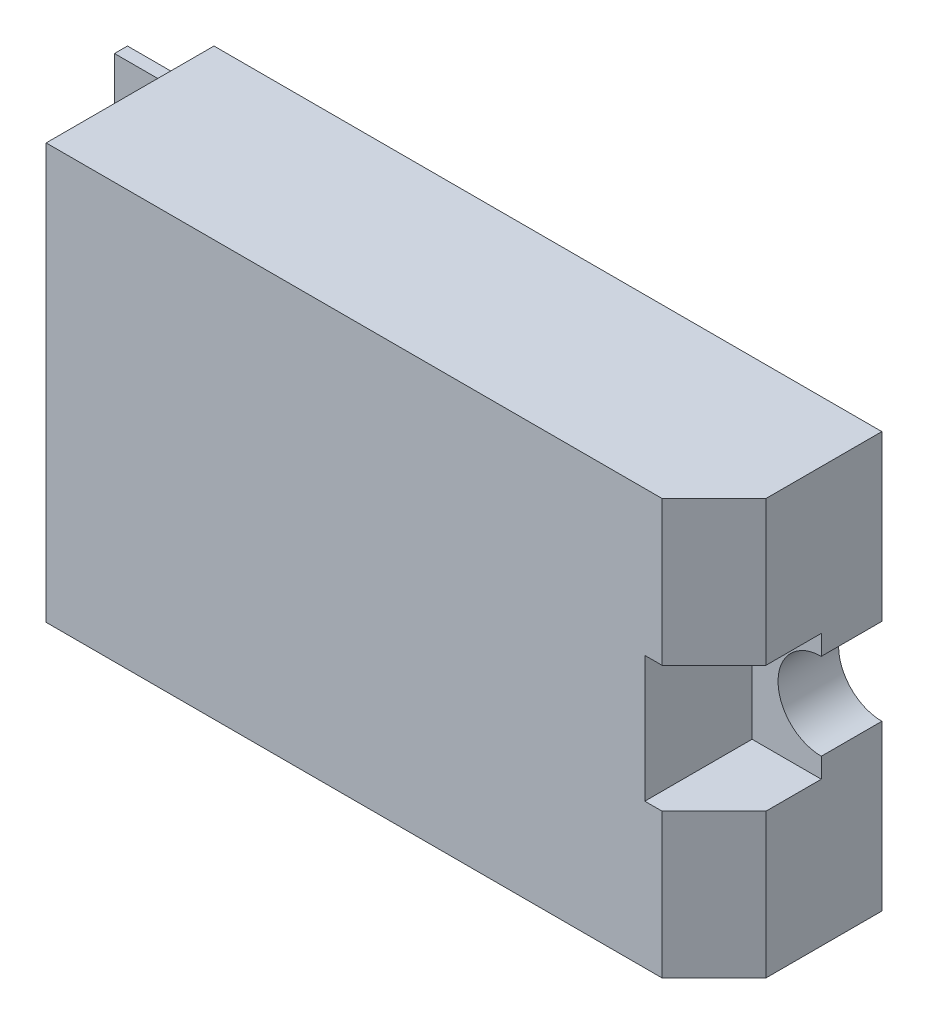
from build123d import *

# Parameters (mm, degrees)
SKETCH_1_W          = 38.6
SKETCH_1_H          = 24
EXTRUDE_1_DEPTH     = 9.7
SKETCH_2_W          = 0.75
SKETCH_2_H          = 21
EXTRUDE_2_DEPTH     = 4
CHAMFER_1_SIZE      = 3
SKETCH_3_W          = 4
SKETCH_3_H          = 7.3
CUT_EXTRUDE_1_DEPTH = 6.2
SKETCH_4_R          = 2.5
CUT_EXTRUDE_2_DEPTH = 82.288953653


with BuildPart() as part:
    # 草图1 → 凸台-拉伸1 (new body)
    with BuildSketch(Plane(origin=(28.693608134, -23.996349429, -44.112502039), x_dir=(1, 0, 0), z_dir=(0, 0, 1))):
        with Locations((-46.492248891, -33.863193326)):
            Rectangle(SKETCH_1_W, SKETCH_1_H)
    extrude(amount=EXTRUDE_1_DEPTH)

    # 草图2 → 凸台-拉伸2 (add)
    with BuildSketch(Plane.ZY.offset(37.098640757)):
        with Locations((-42.737502039, -57.859542755)):
            Rectangle(SKETCH_2_W, SKETCH_2_H)
    extrude(amount=EXTRUDE_2_DEPTH)

    # 倒角1
    chamfer_1_edges = [part.edges().sort_by_distance(p)[0] for p in [
        (1.501359243, -57.859542755, -34.412502039),
    ]]
    chamfer(chamfer_1_edges, length=CHAMFER_1_SIZE)

    # 草图3 → 切除-拉伸1 (cut)
    with BuildSketch(Plane.XY.offset(-34.412502039)):
        with Locations((-0.498640757, -57.859542755)):
            Rectangle(SKETCH_3_W, SKETCH_3_H)
    extrude(amount=-CUT_EXTRUDE_1_DEPTH, mode=Mode.SUBTRACT)

    # 草图4 → 切除-拉伸2 (cut, through all)
    with BuildSketch(Plane.XY.offset(-40.612502039)):
        with Locations((1.501359243, -57.859542755)):
            Circle(SKETCH_4_R)
    extrude(amount=-CUT_EXTRUDE_2_DEPTH, mode=Mode.SUBTRACT)


solid = part.part
